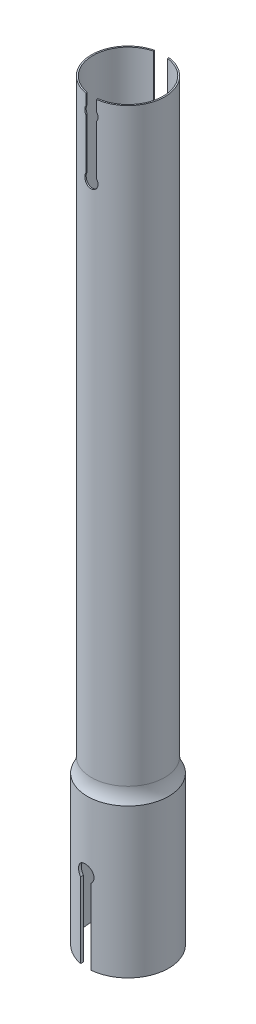
from build123d import *

# Parameters (mm, degrees)
CROQUIS2_R                 = 15
SALIENTE_EXTRUIR2_DEPTH    = 55
CORTAR_EXTRUIR1_DEPTH      = 27.5
CROQUIS6_R                 = 14
CORTAR_EXTRUIR3_DEPTH      = 54
CROQUIS7_R                 = 13.5
SALIENTE_EXTRUIR4_DEPTH    = 223
CORTAR_EXTRUIR5_REACH      = 280.808
CORTAR_EXTRUIR5_END_RADIUS = 13.5
CROQUIS9_R                 = 3.5
CORTAR_EXTRUIR6_DEPTH      = 23
CORTAR_EXTRUIR7_DEPTH      = 23
CROQUIS11_R                = 13
CORTAR_EXTRUIR8_DEPTH      = 291
REDONDEO1_R                = 10


with BuildPart() as part:
    # Croquis2 → Saliente-Extruir2 (new body)
    with BuildSketch(Plane(origin=(0, 0, 0), x_dir=(1, 0, 0), z_dir=(0, 1, 0))):
        with Locations(Location((0, 0, 0), (0, 0, 270))):
            Circle(CROQUIS2_R)
    extrude(amount=SALIENTE_EXTRUIR2_DEPTH)

    # Croquis3 → Cortar-Extruir1 (cut, symmetric)
    with BuildSketch(Plane.XY):
        with BuildLine():
            Line((-2.74026183, 0), (1.25973817, 0))
            Line((1.25973817, 0), (1.25973817, 27.763932023))
            ThreePointArc((1.25973817, 27.763932023), (-0.74026183, 33), (-2.74026183, 27.763932023))
            Line((-2.74026183, 27.763932023), (-2.74026183, 0))
        make_face()
    extrude(amount=CORTAR_EXTRUIR1_DEPTH, both=True, mode=Mode.SUBTRACT)

    # Croquis6 → Cortar-Extruir3 (cut)
    with BuildSketch(Plane(origin=(0, 0, 0), x_dir=(1, 0, 0), z_dir=(0, 1, 0))):
        with Locations(Location((0, 0, 0), (0, 0, 84.83746883))):
            Circle(CROQUIS6_R)
    extrude(amount=CORTAR_EXTRUIR3_DEPTH, mode=Mode.SUBTRACT)

    # Croquis7 → Saliente-Extruir4 (add)
    with BuildSketch(Plane(origin=(0, 55, 0), x_dir=(1, 0, 0), z_dir=(0, 1, 0))):
        with Locations(Location((0, 0, 0), (0, 0, 90))):
            Circle(CROQUIS7_R)
    extrude(amount=SALIENTE_EXTRUIR4_DEPTH)

    # Cortar-Extruir5: up to this cylinder (the profile starts inside it)
    cortar_extruir5_end = Plane(origin=(0, 255.043672, 0), z_dir=(0, -1, 0)) * Cylinder(CORTAR_EXTRUIR5_END_RADIUS, 589.616, mode=Mode.PRIVATE)
    # Croquis8 → Cortar-Extruir5 (cut, up to the surface)
    with BuildSketch(Plane.XY, mode=Mode.PRIVATE) as cortar_extruir5_sk1:
        with BuildLine():
            Line((1.73935776, 278), (-3.26064224, 278))
            Line((-3.26064224, 278), (-3.26064224, 245.330127019))
            ThreePointArc((-3.26064224, 245.330127019), (-0.76064224, 236), (1.73935776, 245.330127019))
            Line((1.73935776, 245.330127019), (1.73935776, 278))
        make_face()
    cortar_extruir5_tool1 = extrude(cortar_extruir5_sk1.sketch, amount=-CORTAR_EXTRUIR5_REACH, mode=Mode.PRIVATE) & cortar_extruir5_end
    add(cortar_extruir5_tool1.solids().sort_by_distance((-0.760642, 255.043672, 0))[0], mode=Mode.SUBTRACT)

    # Croquis9 → Cortar-Extruir6 (cut)
    with BuildSketch(Plane.XY):
        with Locations((0, 209)):
            Circle(CROQUIS9_R)
    extrude(amount=-CORTAR_EXTRUIR6_DEPTH, mode=Mode.SUBTRACT)

    # Croquis10 → Cortar-Extruir7 (cut)
    with BuildSketch(Plane(origin=(0, 0, 0), x_dir=(-1, 0, 0), z_dir=(0, 0, -1))):
        with BuildLine():
            Line((2.26064224, 271.01908507), (2.26064224, 252.48091493))
            ThreePointArc((2.26064224, 252.48091493), (0.22284696, 248.500111609), (-1.73935776, 252.518713023))
            Line((-1.73935776, 252.518713023), (-1.73935776, 270.981286977))
            ThreePointArc((-1.73935776, 270.981286977), (-2.253530287, 272.5), (-1.73935776, 274.018713023))
            Line((-1.73935776, 274.018713023), (-1.73935776, 278))
            Line((-1.73935776, 278), (2.26064224, 278))
            Line((2.26064224, 278), (2.26064224, 273.98091493))
            ThreePointArc((2.26064224, 273.98091493), (2.746469713, 272.5), (2.26064224, 271.01908507))
        make_face()
    extrude(amount=-CORTAR_EXTRUIR7_DEPTH, mode=Mode.SUBTRACT)

    # Croquis11 → Cortar-Extruir8 (cut)
    with BuildSketch(Plane(origin=(0, 0, 0), x_dir=(1, 0, 0), z_dir=(0, 1, 0))):
        with Locations(Location((0, 0, 0), (0, 0, 82.310952423))):
            Circle(CROQUIS11_R)
    extrude(amount=CORTAR_EXTRUIR8_DEPTH, mode=Mode.SUBTRACT)

    # Redondeo1
    # the kernel refuses this fillet: 10 mm, written as the material it adds along each edge
    with BuildSketch(Plane(origin=(0, 55, 0), x_dir=(0, 0, -1), z_dir=(1, 0, 0))) as redondeo1_piece_1:
        with BuildLine():
            CenterArc((23.5, 5.267826876), REDONDEO1_R, 180, 31.788330617)
            Line((13.5, 5.267826876), (13.3, 5.267826876))
            Line((13.3, 5.267826876), (13.3, 0))
            Line((13.3, 0), (13.5, -0.2))
            ThreePointArc((13.5, -0.2), (14.25, -0.2), (14.83, -0.105356538))
            Line((14.83, -0.105356538), (15, 0))
        make_face()
    revolve(axis=Axis((0, 55, 0), (0, 1, 0)))


solid = part.part
